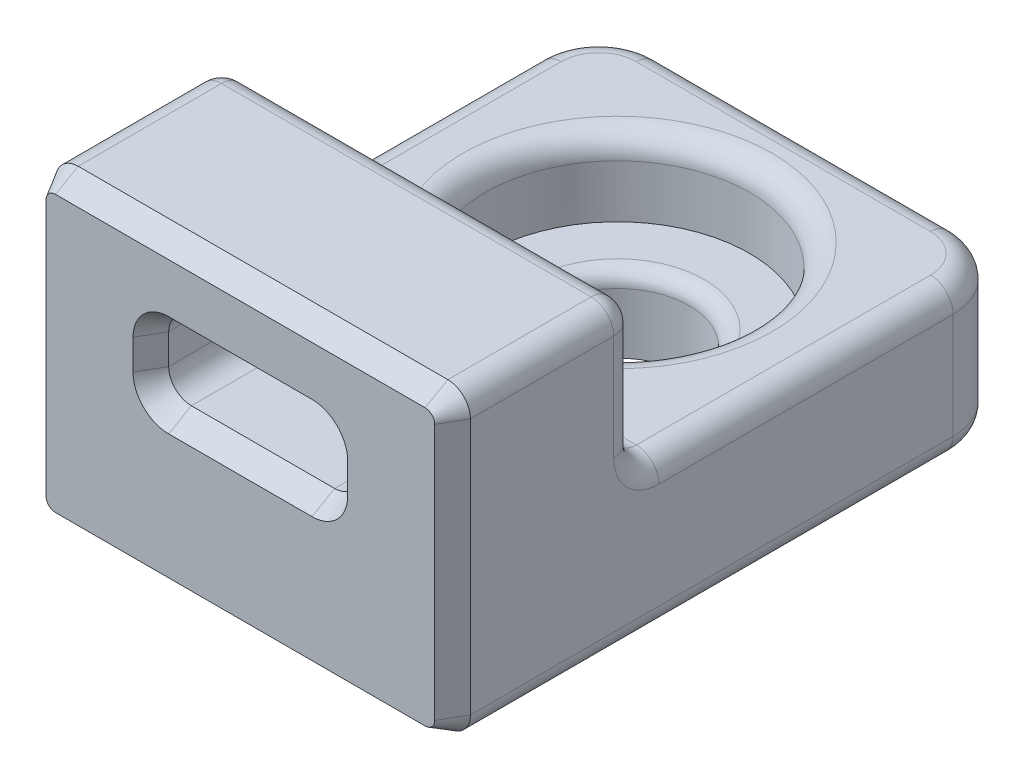
from build123d import *
from OCP.BRepFilletAPI import BRepFilletAPI_MakeChamfer

# Parameters (mm, degrees)
SKETCH1_W           = 13.97
SKETCH1_H           = 19.05
SKETCH1_R           = 2.413
BOSS_EXTRUDE1_DEPTH = 5.08
SKETCH4_W           = 3.81
SKETCH4_H           = 2.54
BOSS_EXTRUDE4_DEPTH = 6.35
SKETCH5_R           = 4.445
CUT_EXTRUDE1_DEPTH  = 2.54
FILLET2_R           = 0.762
FILLET3_R           = 2.032
CHAMFER2_SIZE       = 0.762
CHAMFER2_SIZE2      = 0.439940905
CHAMFER3_SIZE       = 0.762
CHAMFER3_SIZE2      = 0.439940905
FILLET4_R           = 0.508


with BuildPart() as part:
    # Sketch1 → Boss-Extrude1 (new body)
    with BuildSketch(Plane(origin=(0, 0, 0), x_dir=(1, 0, 0), z_dir=(0, 1, 0))):
        Rectangle(SKETCH1_W, SKETCH1_H)
        with Locations(Location((0, 3.175, 0), (0, 0, 270))):
            Circle(SKETCH1_R, mode=Mode.SUBTRACT)
    extrude(amount=BOSS_EXTRUDE1_DEPTH)

    # Sketch4 → Boss-Extrude4 (add)
    with BuildSketch(Plane.XY.offset(9.525)):
        Polygon((-6.985, 10.16), (-6.985, 7.62), (-3.175, 7.62), (3.175, 7.62), (6.985, 7.62), (6.985, 10.16), align=None)
        with Locations((-5.08, 6.35)):
            Rectangle(SKETCH4_W, SKETCH4_H)
        with Locations((5.08, 6.35)):
            Rectangle(SKETCH4_W, SKETCH4_H)
    extrude(amount=-BOSS_EXTRUDE4_DEPTH)

    # Sketch5 → Cut-Extrude1 (cut)
    with BuildSketch(Plane(origin=(0, 5.08, 0), x_dir=(1, 0, 0), z_dir=(0, 1, 0))):
        with Locations(Location((0, 3.175, 0), (0, 0, 270))):
            Circle(SKETCH5_R)
    extrude(amount=-CUT_EXTRUDE1_DEPTH, mode=Mode.SUBTRACT)

    # Fillet2
    fillet2_edges = [part.edges().sort_by_distance(p)[0] for p in [
        (-6.985, 5.08, -3.175),
        (6.985, 5.08, -3.175),
        (0, 10.16, 3.175),
        (-6.985, 10.16, 6.35),
        (6.985, 7.62, 3.175),
        (6.985, 10.16, 6.35),
        (3.175, 5.08, 6.35),
        (0, 7.62, 3.175),
        (3.175, 7.62, 6.35),
        (-3.175, 6.35, 3.175),
        (-3.175, 7.62, 6.35),
        (-3.175, 5.08, 6.35),
        (-6.985, 7.62, 3.175),
        (5.08, 5.08, 3.175),
        (3.175, 6.35, 3.175),
        (-5.08, 5.08, 3.175),
        (0, 5.08, -7.62),
        (-6.985, 0, 0),
        (0, 0, -9.525),
        (6.985, 0, 0),
        (0, 5.08, -9.525),
    ]]
    fillet(fillet2_edges, radius=FILLET2_R)

    # Fillet3
    # the kernel refuses this fillet: 2.032 mm, written as the material it takes off along each edge
    with BuildSketch(Plane(origin=(-4.953, 5.08, -7.493), x_dir=(0, 0, -1), z_dir=(1, 0, 0))) as fillet3_piece_1:
        with BuildLine():
            CenterArc((1.27, -0.762), 0.762, 0, 90)
            Line((2.032, -0.762), (2.032, 0))
            Line((2.032, 0), (1.27, 0))
        make_face()
    revolve(axis=Axis((-4.953, 5.08, -7.493), (0, 1, 0)), revolution_arc=90, mode=Mode.SUBTRACT)
    with BuildSketch(Plane(origin=(4.953, 5.08, -7.493), x_dir=(1, 0, 0), z_dir=(0, 0, 1))) as fillet3_piece_2:
        with BuildLine():
            CenterArc((1.27, -0.762), 0.762, 0, 90)
            Line((2.032, -0.762), (2.032, 0))
            Line((2.032, 0), (1.27, 0))
        make_face()
    revolve(axis=Axis((4.953, 5.08, -7.493), (0, 1, 0)), revolution_arc=90, mode=Mode.SUBTRACT)
    with BuildSketch(Plane(origin=(-4.953, 0, -7.493), x_dir=(-1, 0, 0), z_dir=(0, 0, 1))) as fillet3_piece_3:
        with BuildLine():
            CenterArc((1.27, -0.762), 0.762, 0, 90)
            Line((2.032, -0.762), (2.032, 0))
            Line((2.032, 0), (1.27, 0))
        make_face()
    revolve(axis=Axis((-4.953, 0, -7.493), (0, -1, 0)), revolution_arc=90, mode=Mode.SUBTRACT)
    with BuildSketch(Plane(origin=(4.953, 0, -7.493), x_dir=(0, 0, -1), z_dir=(-1, 0, 0))) as fillet3_piece_4:
        with BuildLine():
            CenterArc((1.27, -0.762), 0.762, 0, 90)
            Line((2.032, -0.762), (2.032, 0))
            Line((2.032, 0), (1.27, 0))
        make_face()
    revolve(axis=Axis((4.953, 0, -7.493), (0, -1, 0)), revolution_arc=90, mode=Mode.SUBTRACT)
    with BuildSketch(Plane(origin=(6.985, 0, -9.525), x_dir=(0, 0, 1), z_dir=(0, 1, 0))) as fillet3_piece_5:
        with BuildLine():
            CenterArc((FILLET3_R, -FILLET3_R), FILLET3_R, 90, 90)
            Line((0, -FILLET3_R), (0, 0))
            Line((0, 0), (FILLET3_R, 0))
        make_face()
    extrude(amount=5.08, mode=Mode.SUBTRACT)
    with BuildSketch(Plane(origin=(-6.985, 0, -9.525), x_dir=(0, 0, 1), z_dir=(0, 1, 0))) as fillet3_piece_6:
        with BuildLine():
            CenterArc((FILLET3_R, FILLET3_R), FILLET3_R, 180, 90)
            Line((0, FILLET3_R), (0, 0))
            Line((0, 0), (FILLET3_R, 0))
        make_face()
    extrude(amount=5.08, mode=Mode.SUBTRACT)

    # Chamfer2: one chamfer whose edges measure the first distance from different faces: ONE call of the kernel's chamfer builder (chamfer() names one face for all edges)
    chamfer2_edges_1 = [part.edges().sort_by_distance(p)[0] for p in [
        (0, 5.08, 9.525),
    ]]
    chamfer2_side_1 = [part.faces().sort_by_distance(p)[0] for p in [
        (-2.19178656, 5.08, 6.731),
    ]]
    chamfer2_edges_2 = [part.edges().sort_by_distance(p)[0] for p in [
        (3.175, 6.35, 9.525),
    ]]
    chamfer2_side_2 = [part.faces().sort_by_distance(p)[0] for p in [
        (3.175, 6.35, 6.731),
    ]]
    chamfer2_edges_3 = [part.edges().sort_by_distance(p)[0] for p in [
        (-3.175, 6.35, 9.525),
    ]]
    chamfer2_side_3 = [part.faces().sort_by_distance(p)[0] for p in [
        (-3.175, 6.35, 6.731),
    ]]
    chamfer2_edges_4 = [part.edges().sort_by_distance(p)[0] for p in [
        (0, 7.62, 9.525),
    ]]
    chamfer2_side_4 = [part.faces().sort_by_distance(p)[0] for p in [
        (0, 7.62, 6.731),
    ]]
    chamfer2_edges_5 = [part.edges().sort_by_distance(p)[0] for p in [
        (2.951815367, 5.303184633, 9.525),
    ]]
    chamfer2_side_5 = [part.faces().sort_by_distance(p)[0] for p in [
        (2.951815367, 5.303184633, 6.731),
    ]]
    chamfer2_edges_6 = [part.edges().sort_by_distance(p)[0] for p in [
        (-2.951815367, 5.303184633, 9.525),
    ]]
    chamfer2_side_6 = [part.faces().sort_by_distance(p)[0] for p in [
        (-2.951815367, 5.303184633, 6.731),
    ]]
    chamfer2_edges_7 = [part.edges().sort_by_distance(p)[0] for p in [
        (2.951815367, 7.396815367, 9.525),
    ]]
    chamfer2_side_7 = [part.faces().sort_by_distance(p)[0] for p in [
        (2.951815367, 7.396815367, 6.731),
    ]]
    chamfer2_edges_8 = [part.edges().sort_by_distance(p)[0] for p in [
        (-2.951815367, 7.396815367, 9.525),
    ]]
    chamfer2_side_8 = [part.faces().sort_by_distance(p)[0] for p in [
        (-2.951815367, 7.396815367, 6.731),
    ]]
    chamfer2 = BRepFilletAPI_MakeChamfer(part.part.solid().wrapped)
    for e in chamfer2_edges_1:
        chamfer2.Add(CHAMFER2_SIZE, CHAMFER2_SIZE2, e.wrapped, chamfer2_side_1[0].wrapped)  # the first distance lies on this face
    for e in chamfer2_edges_2:
        chamfer2.Add(CHAMFER2_SIZE, CHAMFER2_SIZE2, e.wrapped, chamfer2_side_2[0].wrapped)  # the first distance lies on this face
    for e in chamfer2_edges_3:
        chamfer2.Add(CHAMFER2_SIZE, CHAMFER2_SIZE2, e.wrapped, chamfer2_side_3[0].wrapped)  # the first distance lies on this face
    for e in chamfer2_edges_4:
        chamfer2.Add(CHAMFER2_SIZE, CHAMFER2_SIZE2, e.wrapped, chamfer2_side_4[0].wrapped)  # the first distance lies on this face
    for e in chamfer2_edges_5:
        chamfer2.Add(CHAMFER2_SIZE, CHAMFER2_SIZE2, e.wrapped, chamfer2_side_5[0].wrapped)  # the first distance lies on this face
    for e in chamfer2_edges_6:
        chamfer2.Add(CHAMFER2_SIZE, CHAMFER2_SIZE2, e.wrapped, chamfer2_side_6[0].wrapped)  # the first distance lies on this face
    for e in chamfer2_edges_7:
        chamfer2.Add(CHAMFER2_SIZE, CHAMFER2_SIZE2, e.wrapped, chamfer2_side_7[0].wrapped)  # the first distance lies on this face
    for e in chamfer2_edges_8:
        chamfer2.Add(CHAMFER2_SIZE, CHAMFER2_SIZE2, e.wrapped, chamfer2_side_8[0].wrapped)  # the first distance lies on this face
    add(Compound.cast(chamfer2.Shape()), mode=Mode.REPLACE)

    # Chamfer3: one chamfer whose edges measure the first distance from different faces: ONE call of the kernel's chamfer builder (chamfer() names one face for all edges)
    chamfer3_edges_1 = [part.edges().sort_by_distance(p)[0] for p in [
        (6.985, 5.08, 9.525),
    ]]
    chamfer3_side_1 = [part.faces().sort_by_distance(p)[0] for p in [
        (6.985, 3.922875555, 2.845032122),
    ]]
    chamfer3_edges_2 = [part.edges().sort_by_distance(p)[0] for p in [
        (-6.985, 5.08, 9.525),
    ]]
    chamfer3_side_2 = [part.faces().sort_by_distance(p)[0] for p in [
        (-6.985, 3.922875555, 2.845032122),
    ]]
    chamfer3_edges_3 = [part.edges().sort_by_distance(p)[0] for p in [
        (0, 0, 9.525),
    ]]
    chamfer3_side_3 = [part.faces().sort_by_distance(p)[0] for p in [
        (0, 0, 0.722183851),
    ]]
    chamfer3_edges_4 = [part.edges().sort_by_distance(p)[0] for p in [
        (0, 10.16, 9.525),
    ]]
    chamfer3_side_4 = [part.faces().sort_by_distance(p)[0] for p in [
        (0, 10.16, 6.731),
    ]]
    chamfer3_edges_5 = [part.edges().sort_by_distance(p)[0] for p in [
        (6.761815367, 9.936815367, 9.525),
    ]]
    chamfer3_side_5 = [part.faces().sort_by_distance(p)[0] for p in [
        (6.761815367, 9.936815367, 6.731),
    ]]
    chamfer3_edges_6 = [part.edges().sort_by_distance(p)[0] for p in [
        (-6.761815367, 9.936815367, 9.525),
    ]]
    chamfer3_side_6 = [part.faces().sort_by_distance(p)[0] for p in [
        (-6.761815367, 9.936815367, 6.731),
    ]]
    chamfer3_edges_7 = [part.edges().sort_by_distance(p)[0] for p in [
        (-6.761815367, 0.223184633, 9.525),
    ]]
    chamfer3_side_7 = [part.faces().sort_by_distance(p)[0] for p in [
        (-6.761815367, 0.223184633, 1.016),
    ]]
    chamfer3_edges_8 = [part.edges().sort_by_distance(p)[0] for p in [
        (6.761815367, 0.223184633, 9.525),
    ]]
    chamfer3_side_8 = [part.faces().sort_by_distance(p)[0] for p in [
        (6.761815367, 0.223184633, 1.016),
    ]]
    chamfer3 = BRepFilletAPI_MakeChamfer(part.part.solid().wrapped)
    for e in chamfer3_edges_1:
        chamfer3.Add(CHAMFER3_SIZE, CHAMFER3_SIZE2, e.wrapped, chamfer3_side_1[0].wrapped)  # the first distance lies on this face
    for e in chamfer3_edges_2:
        chamfer3.Add(CHAMFER3_SIZE, CHAMFER3_SIZE2, e.wrapped, chamfer3_side_2[0].wrapped)  # the first distance lies on this face
    for e in chamfer3_edges_3:
        chamfer3.Add(CHAMFER3_SIZE, CHAMFER3_SIZE2, e.wrapped, chamfer3_side_3[0].wrapped)  # the first distance lies on this face
    for e in chamfer3_edges_4:
        chamfer3.Add(CHAMFER3_SIZE, CHAMFER3_SIZE2, e.wrapped, chamfer3_side_4[0].wrapped)  # the first distance lies on this face
    for e in chamfer3_edges_5:
        chamfer3.Add(CHAMFER3_SIZE, CHAMFER3_SIZE2, e.wrapped, chamfer3_side_5[0].wrapped)  # the first distance lies on this face
    for e in chamfer3_edges_6:
        chamfer3.Add(CHAMFER3_SIZE, CHAMFER3_SIZE2, e.wrapped, chamfer3_side_6[0].wrapped)  # the first distance lies on this face
    for e in chamfer3_edges_7:
        chamfer3.Add(CHAMFER3_SIZE, CHAMFER3_SIZE2, e.wrapped, chamfer3_side_7[0].wrapped)  # the first distance lies on this face
    for e in chamfer3_edges_8:
        chamfer3.Add(CHAMFER3_SIZE, CHAMFER3_SIZE2, e.wrapped, chamfer3_side_8[0].wrapped)  # the first distance lies on this face
    add(Compound.cast(chamfer3.Shape()), mode=Mode.REPLACE)

    # Fillet4
    fillet4_edges = [part.edges().sort_by_distance(p)[0] for p in [
        (0, 2.54, -5.588),
    ]]
    fillet(fillet4_edges, radius=FILLET4_R)


solid = part.part
